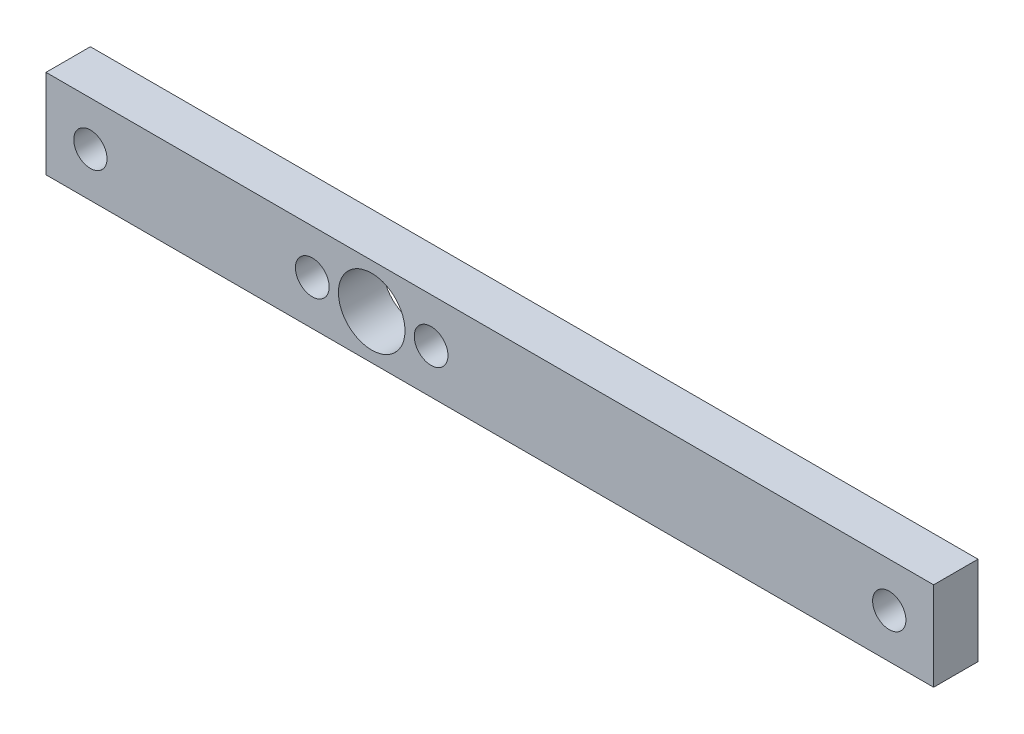
from build123d import *

# Parameters (mm, degrees)
SKETCH1_W           = 127
SKETCH1_H           = 12.7
SKETCH1_R           = 2.413
SKETCH1_R_2         = 2.38125
SKETCH1_R_3         = 4.7625
BOSS_EXTRUDE1_DEPTH = 6.35


with BuildPart() as part:
    # Sketch1 → Boss-Extrude1 (new body)
    with BuildSketch(Plane.XY):
        with Locations((63.5, 6.35)):
            Rectangle(SKETCH1_W, SKETCH1_H)
        with Locations((38.1, 6.35)):
            Circle(SKETCH1_R, mode=Mode.SUBTRACT)
        with Locations((55.1000168, 6.35)):
            Circle(SKETCH1_R, mode=Mode.SUBTRACT)
        with Locations((6.35, 6.35)):
            Circle(SKETCH1_R_2, mode=Mode.SUBTRACT)
        with Locations((120.65, 6.35)):
            Circle(SKETCH1_R_2, mode=Mode.SUBTRACT)
        with Locations((46.6000084, 6.35)):
            Circle(SKETCH1_R_3, mode=Mode.SUBTRACT)
    extrude(amount=BOSS_EXTRUDE1_DEPTH)


solid = part.part
